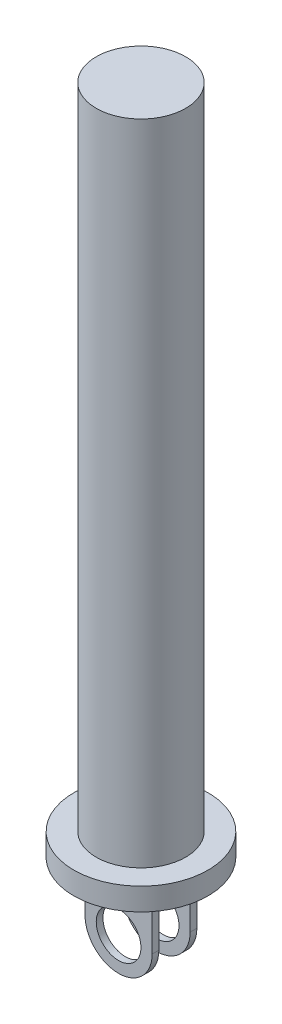
from build123d import *

# Parameters (mm, degrees)
SKETCH1_R               = 15
BOSS_EXTRUDE1_DEPTH     = 5
SKETCH2_R               = 10
BOSS_EXTRUDE2_DEPTH     = 145
SKETCH3_W               = 15
SKETCH3_H               = 10
BOSS_EXTRUDE3_DEPTH     = 20
CUT_EXTRUDE1_DEPTH      = 153.069063257
CUT_EXTRUDE1_DEPTH_BACK = 153.069063257
SKETCH4_R               = 5
CUT_EXTRUDE2_DEPTH      = 172.31841699
CUT_EXTRUDE2_DEPTH_BACK = 15
SKETCH5_W               = 15
SKETCH5_H               = 7
FILLET1_R               = 7.5


with BuildPart() as part:
    # Sketch1 → Boss-Extrude1 (new body)
    with BuildSketch(Plane(origin=(0, 0, 0), x_dir=(1, 0, 0), z_dir=(0, 1, 0))):
        with Locations(Location((0, 0, 0), (0, 0, 270))):
            Circle(SKETCH1_R)
    extrude(amount=BOSS_EXTRUDE1_DEPTH)

    # Sketch2 → Boss-Extrude2 (add)
    with BuildSketch(Plane(origin=(0, 5, 0), x_dir=(1, 0, 0), z_dir=(0, 1, 0))):
        with Locations(Location((0, 0, 0), (0, 0, 270))):
            Circle(SKETCH2_R)
    extrude(amount=BOSS_EXTRUDE2_DEPTH)

    # Sketch3 → Boss-Extrude3 (add)
    with BuildSketch(Plane.XZ):
        Rectangle(SKETCH3_W, SKETCH3_H)
    extrude(amount=BOSS_EXTRUDE3_DEPTH)

    # Sketch4 → Cut-Extrude1 (cut, two sides: drawn at the far end of the back side and taken through both)
    with BuildSketch(Plane.XY.offset(5).offset(-CUT_EXTRUDE1_DEPTH_BACK)):
        with Locations((0, -12.5)):
            Circle(SKETCH4_R)
    extrude(amount=CUT_EXTRUDE1_DEPTH + CUT_EXTRUDE1_DEPTH_BACK, mode=Mode.SUBTRACT)

    # Sketch5 → Cut-Extrude2 (cut, two sides: drawn at the far end of the back side and taken through both)
    with BuildSketch(Plane.XZ.offset(20).offset(-CUT_EXTRUDE2_DEPTH_BACK)):
        Rectangle(SKETCH5_W, SKETCH5_H)
    extrude(amount=CUT_EXTRUDE2_DEPTH + CUT_EXTRUDE2_DEPTH_BACK, mode=Mode.SUBTRACT)

    # Fillet1
    fillet1_edges = [part.edges().sort_by_distance(p)[0] for p in [
        (7.5, -20, 4.25),
        (7.5, -20, -4.25),
        (-7.5, -20, 4.25),
        (-7.5, -20, -4.25),
    ]]
    fillet(fillet1_edges, radius=FILLET1_R - 0.0001)  # a hair under: the kernel refuses the full size


solid = part.part
